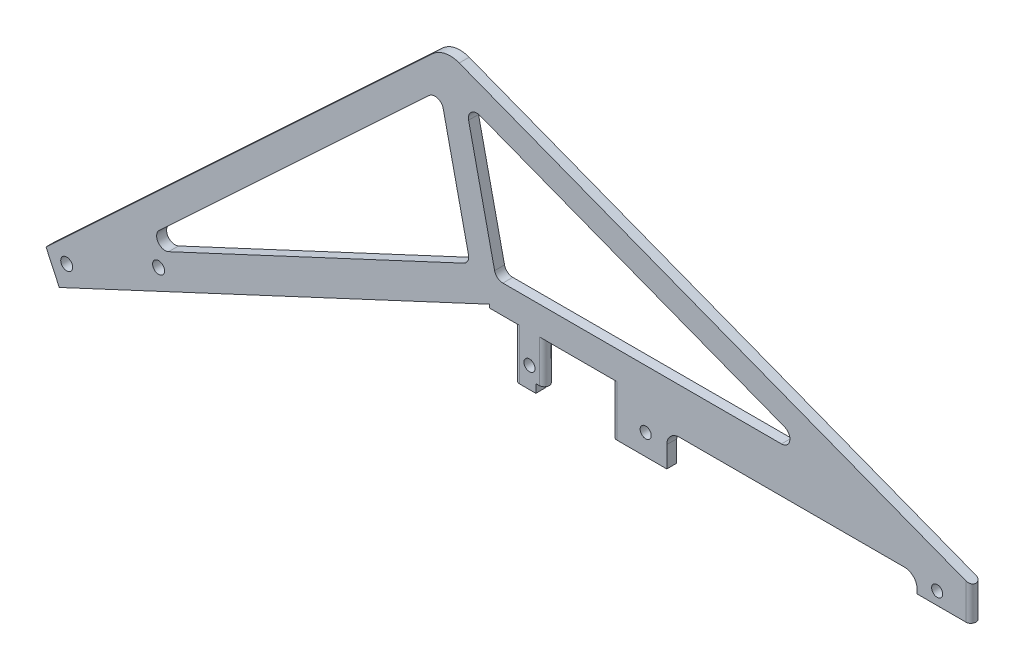
from build123d import *

# Parameters (mm, degrees)
BOSS_EXTRUDE1_DEPTH     = 3.7338
BOSS_EXTRUDE2_DEPTH     = 3.7338
CUT_EXTRUDE1_DEPTH      = 197.398400929
FILLET7_R               = 9.525
FILLET8_R               = 3.175
F_8_32_TAPPED_HOLE2_D   = 4.1656
FILLET3_RADIUS          = 1.8669
FILLET3_LENGTH          = 19.05
FILLET4_RADIUS          = 1.8669
FILLET4_LENGTH          = 19.05
FILLET5_RADIUS          = 1.8669
FILLET5_LENGTH          = 19.05
FILLET6_START           = -20
FILLET6_DEPTH           = 22
CUT_EXTRUDE2_START      = -5
CUT_EXTRUDE2_OUTLINE_R  = 2.2479
CUT_EXTRUDE2_DEPTH      = 6
CUT_EXTRUDE3_DEPTH      = 196.819265209
SKETCH15_W              = 94.065777876
SKETCH15_H              = 7.9375
CUT_EXTRUDE4_DEPTH      = 196.819265209
SKETCH16_W              = 20.234222124
SKETCH16_H              = 6.35
CUT_EXTRUDE5_DEPTH      = 196.819265209
CUT_EXTRUDE6_DEPTH      = 196.819265209
CUT_EXTRUDE6_DEPTH_BACK = 196.819265209
SKETCH17_W              = 3.175
SKETCH17_H              = 3.175


with BuildPart() as part:
    # Sketch1 → Boss-Extrude1 (new body)
    with BuildSketch(Plane.XY):
        Polygon((0, 0), (9.525, 0), (9.525, -19.05), (20.6375, -19.05), (20.6375, 0), (46.0375, 0), (46.0375, -19.05), (180.975, -19.05), (180.975, 0), (-16.893133293, 76.2), align=None)
    extrude(amount=BOSS_EXTRUDE1_DEPTH)

    # Sketch7 → Boss-Extrude2 (add)
    with BuildSketch(Plane.XY.offset(3.7338)):
        Polygon((-161.613635382, -74.129081959), (-0.247657199, 1.117109433), (-16.893133293, 76.2), (-166.605179671, -63.424680687), align=None)
    extrude(amount=-BOSS_EXTRUDE2_DEPTH)

    # Sketch8 → Cut-Extrude1 (cut, through all)
    with BuildSketch(Plane.XY.offset(3.7338)):
        Polygon((2.518832326, 10.642109433), (126.836493994, 10.642109433), (-9.085614858, 62.98638803), align=None)
        Polygon((-18.542737866, 61.637057548), (-138.674453357, -50.400369109), (-7.28718114, 10.86652211), align=None)
    extrude(amount=-CUT_EXTRUDE1_DEPTH, mode=Mode.SUBTRACT)

    # Fillet7
    fillet7_edges = [part.edges().sort_by_distance(p)[0] for p in [
        (-16.893133293, 76.2, 1.8669),
    ]]
    fillet(fillet7_edges, radius=FILLET7_R)

    # Fillet8
    fillet8_edges = [part.edges().sort_by_distance(p)[0] for p in [
        (-9.085614858, 62.98638803, 1.8669),
        (126.836493994, 10.642109433, 1.8669),
        (2.518832326, 10.642109433, 1.8669),
        (-7.28718114, 10.86652211, 1.8669),
        (-138.674453357, -50.400369109, 1.8669),
        (-18.542737866, 61.637057548, 1.8669),
    ]]
    fillet(fillet8_edges, radius=FILLET8_R)

    # #8-32 Tapped Hole2 (through all)
    with Locations(Plane.XY.offset(3.7338)):
        with Locations((15.08125, -11.1125), (58.7375, -11.1125), (168.275, -7.9375)):
            Hole(F_8_32_TAPPED_HOLE2_D / 2)

    # Fillet3: full round fillet: the end face becomes a half cylinder, R = half its width
    fillet3_face = Plane((9.525, -9.525, 1.8669), x_dir=(0, 1, 0), z_dir=(-1, 0, 0))  # on the end face: x along it, z out of the body
    fillet3_slab = fillet3_face.offset(-FILLET3_RADIUS / 2) * Box(FILLET3_LENGTH, 2 * FILLET3_RADIUS, FILLET3_RADIUS, mode=Mode.PRIVATE)  # the body's end, R deep
    fillet3_round = Plane((11.3919, -9.525, 1.8669), x_dir=(-1, 0, 0), z_dir=(0, 1, 0)) * Cylinder(FILLET3_RADIUS, FILLET3_LENGTH, mode=Mode.PRIVATE)  # its axis R under the face
    add(fillet3_slab - fillet3_round, mode=Mode.SUBTRACT)

    # Fillet4: full round fillet: the end face becomes a half cylinder, R = half its width
    fillet4_face = Plane((20.6375, -9.525, 1.8669), x_dir=(0, 1, 0), z_dir=(1, 0, 0))  # on the end face: x along it, z out of the body
    fillet4_slab = fillet4_face.offset(-FILLET4_RADIUS / 2) * Box(FILLET4_LENGTH, 2 * FILLET4_RADIUS, FILLET4_RADIUS, mode=Mode.PRIVATE)  # the body's end, R deep
    fillet4_round = Plane((18.7706, -9.525, 1.8669), x_dir=(1, 0, 0), z_dir=(0, 1, 0)) * Cylinder(FILLET4_RADIUS, FILLET4_LENGTH, mode=Mode.PRIVATE)  # its axis R under the face
    add(fillet4_slab - fillet4_round, mode=Mode.SUBTRACT)

    # Fillet5: full round fillet: the end face becomes a half cylinder, R = half its width
    fillet5_face = Plane((46.0375, -9.525, 1.8669), x_dir=(0, -1, 0), z_dir=(-1, 0, 0))  # on the end face: x along it, z out of the body
    fillet5_slab = fillet5_face.offset(-FILLET5_RADIUS / 2) * Box(FILLET5_LENGTH, 2 * FILLET5_RADIUS, FILLET5_RADIUS, mode=Mode.PRIVATE)  # the body's end, R deep
    fillet5_round = Plane((47.9044, -9.525, 1.8669), x_dir=(-1, 0, 0), z_dir=(0, -1, 0)) * Cylinder(FILLET5_RADIUS, FILLET5_LENGTH, mode=Mode.PRIVATE)  # its axis R under the face
    add(fillet5_slab - fillet5_round, mode=Mode.SUBTRACT)

    # Fillet6: read off the stored shape, not the designer's step
    # Fillet6 outline → Fillet6 (cut)
    with BuildSketch(Plane(origin=(0, 0, 0), x_dir=(1, 0, 0), z_dir=(0, 1, 0)).offset(FILLET6_START)):
        with BuildLine():
            ThreePointArc((179.1081, 0), (180.42819765, -0.54680235), (180.975, -1.8669))
            Line((180.975, -1.8669), (180.975, 0))
            Line((180.975, 0), (179.1081, 0))
        make_face()
        with BuildLine():
            ThreePointArc((180.975, -1.8669), (180.42819765, -3.18699765), (179.1081, -3.7338))
            Line((179.1081, -3.7338), (180.975, -3.7338))
            Line((180.975, -3.7338), (180.975, -1.8669))
        make_face()
    extrude(amount=FILLET6_DEPTH, mode=Mode.SUBTRACT)

    # Cut-Extrude2: read off the stored shape, not the designer's step
    # Cut-Extrude2 outline → Cut-Extrude2 (cut)
    with BuildSketch(Plane.XY.offset(3.7338).offset(CUT_EXTRUDE2_START)):
        with Locations((-124.299564913, -48.97170394)):
            Circle(CUT_EXTRUDE2_OUTLINE_R)
        with Locations((-158.829891599, -65.073459713)):
            Circle(CUT_EXTRUDE2_OUTLINE_R)
        Polygon((-0.247657199, 1.117109433), (0, 0), (0, 1.232593882), align=None)
    extrude(amount=CUT_EXTRUDE2_DEPTH, mode=Mode.SUBTRACT)

    # Sketch14 → Cut-Extrude3 (cut, through all)
    with BuildSketch(Plane.XY.offset(3.7338)):
        with BuildLine():
            Line((71.4375, -6.35), (155.978277876, -6.35))
            ThreePointArc((155.978277876, -6.35), (160.740777876, -11.1125), (155.978277876, -15.875))
            Line((155.978277876, -15.875), (71.4375, -15.875))
            ThreePointArc((71.4375, -15.875), (66.675, -11.1125), (71.4375, -6.35))
        make_face()
    extrude(amount=-CUT_EXTRUDE3_DEPTH, mode=Mode.SUBTRACT)

    # Sketch15 → Cut-Extrude4 (cut, through all)
    with BuildSketch(Plane.XY.offset(3.7338)):
        with Locations((113.707888938, -15.08125)):
            Rectangle(SKETCH15_W, SKETCH15_H)
    extrude(amount=-CUT_EXTRUDE4_DEPTH, mode=Mode.SUBTRACT)

    # Sketch16 → Cut-Extrude5 (cut, through all)
    with BuildSketch(Plane.XY.offset(3.7338)):
        with Locations((170.857888938, -15.875)):
            Rectangle(SKETCH16_W, SKETCH16_H)
    extrude(amount=-CUT_EXTRUDE5_DEPTH, mode=Mode.SUBTRACT)

    # Sketch17 → Cut-Extrude6 (cut, two sides: drawn at the far end of the back side and taken through both)
    with BuildSketch(Plane.XY.offset(3.7338).offset(-CUT_EXTRUDE6_DEPTH_BACK)):
        with Locations((19.05, -17.4625)):
            Rectangle(SKETCH17_W, SKETCH17_H)
    extrude(amount=CUT_EXTRUDE6_DEPTH + CUT_EXTRUDE6_DEPTH_BACK, mode=Mode.SUBTRACT)


solid = part.part
